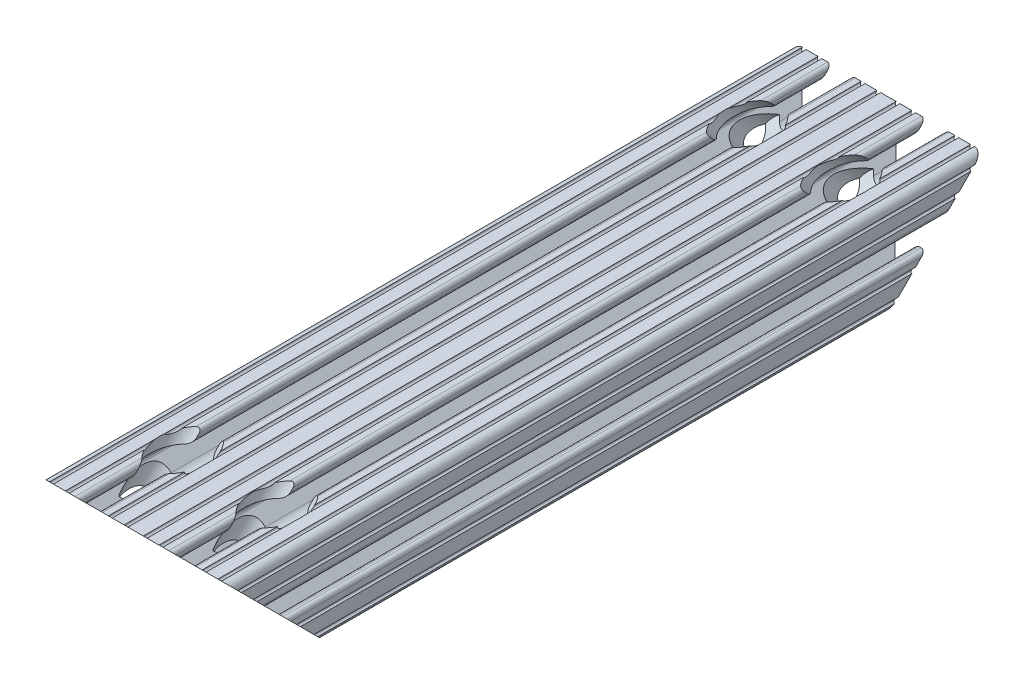
from build123d import *

# Parameters (mm, degrees)
SKETCH1_R               = 3.3274
BOSS_EXTRUDE1_DEPTH     = 152.4
CUT_EXTRUDE1_DEPTH      = 159.253130836
CUT_EXTRUDE1_DEPTH_BACK = 159.253130836


with BuildPart() as part:
    # Sketch1 → Boss-Extrude1 (new, symmetric)
    with BuildSketch(Plane.XY):
        with BuildLine():
            Line((8.915756335, 13.510467785), (8.915756335, 14.073045205))
            ThreePointArc((8.915756335, 14.073045205), (9.176138407, 14.701663134), (9.804756335, 14.962045205))
            Line((9.804756335, 14.962045205), (13.4112, 14.962045205))
            ThreePointArc((13.4112, 14.962045205), (14.524751759, 15.423293446), (14.986, 16.536845205))
            Line((14.986, 16.536845205), (14.986, 17.472817786))
            ThreePointArc((14.986, 17.472817786), (14.531070222, 18.571115427), (13.432772581, 19.026045205))
            Line((13.432772581, 19.026045205), (10.997536067, 19.026045205))
            ThreePointArc((10.997536067, 19.026045205), (10.235536067, 18.264045205), (9.473536067, 19.026045205))
            Line((9.473536067, 19.026045205), (4.645121376, 19.026045205))
            ThreePointArc((4.645121376, 19.026045205), (3.883121376, 18.264045205), (3.121121376, 19.026045205))
            Line((3.121121376, 19.026045205), (-3.121121376, 19.026045205))
            ThreePointArc((-3.121121376, 19.026045205), (-3.883121376, 18.264045205), (-4.645121376, 19.026045205))
            Line((-4.645121376, 19.026045205), (-9.473536067, 19.026045205))
            ThreePointArc((-9.473536067, 19.026045205), (-10.235536067, 18.264045205), (-10.997536067, 19.026045205))
            Line((-10.997536067, 19.026045205), (-13.432772581, 19.026045205))
            ThreePointArc((-13.432772581, 19.026045205), (-14.531070222, 18.571115427), (-14.986, 17.472817786))
            Line((-14.986, 17.472817786), (-14.986, 16.536845205))
            ThreePointArc((-14.986, 16.536845205), (-14.524751759, 15.423293446), (-13.4112, 14.962045205))
            Line((-13.4112, 14.962045205), (-9.804756335, 14.962045205))
            ThreePointArc((-9.804756335, 14.962045205), (-9.176138407, 14.701663134), (-8.915756335, 14.073045205))
            Line((-8.915756335, 14.073045205), (-8.915756335, 13.510467785))
            ThreePointArc((-8.915756335, 13.510467785), (-8.983427007, 13.170263239), (-9.176136839, 12.881851425))
            Line((-9.176136839, 12.881851425), (-13.852498595, 8.205466336))
            ThreePointArc((-13.852498595, 8.205466336), (-15.393447522, 7.17583301), (-17.211122763, 6.814273746))
            Line((-17.211122763, 6.814273746), (-20.888877237, 6.814273746))
            ThreePointArc((-20.888877237, 6.814273746), (-22.706552478, 7.17583301), (-24.247501405, 8.205466336))
            Line((-24.247501405, 8.205466336), (-28.923863161, 12.881851425))
            ThreePointArc((-28.923863161, 12.881851425), (-29.116572993, 13.170263239), (-29.184243665, 13.510467785))
            Line((-29.184243665, 13.510467785), (-29.184243665, 14.073045205))
            ThreePointArc((-29.184243665, 14.073045205), (-28.923861593, 14.701663134), (-28.295243665, 14.962045205))
            Line((-28.295243665, 14.962045205), (-24.6888, 14.962045205))
            ThreePointArc((-24.6888, 14.962045205), (-23.575248241, 15.423293446), (-23.114, 16.536845205))
            Line((-23.114, 16.536845205), (-23.114, 17.456610551))
            ThreePointArc((-23.114, 17.456610551), (-23.53023695, 18.523253274), (-24.558915796, 19.026045205))
            Line((-24.558915796, 19.026045205), (-26.945817468, 19.026045205))
            ThreePointArc((-26.945817468, 19.026045205), (-27.707817468, 18.264045205), (-28.469817468, 19.026045205))
            Line((-28.469817468, 19.026045205), (-33.296256263, 19.026045205))
            ThreePointArc((-33.296256263, 19.026045205), (-34.081312886, 18.287821595), (-34.819536496, 19.072878217))
            ThreePointArc((-34.819536496, 19.072878217), (-37.148019028, 18.168059227), (-38.137614868, 15.874322456))
            ThreePointArc((-38.137614868, 15.874322456), (-37.338232276, 15.132064588), (-38.1, 14.35125142))
            Line((-38.1, 14.35125142), (-38.1, 9.525746878))
            ThreePointArc((-38.1, 9.525746878), (-37.338, 8.763746878), (-38.1, 8.001746878))
            Line((-38.1, 8.001746878), (-38.1, 5.614845205))
            ThreePointArc((-38.1, 5.614845205), (-37.638751759, 4.501293446), (-36.5252, 4.040045205))
            Line((-36.5252, 4.040045205), (-35.6108, 4.040045205))
            ThreePointArc((-35.6108, 4.040045205), (-34.497248241, 4.501293446), (-34.036, 5.614845205))
            Line((-34.036, 5.614845205), (-34.036, 9.374045205))
            ThreePointArc((-34.036, 9.374045205), (-33.775617928, 10.002663134), (-33.147, 10.263045205))
            Line((-33.147, 10.263045205), (-32.420656743, 10.263045205))
            ThreePointArc((-32.420656743, 10.263045205), (-32.080450147, 10.195373685), (-31.792037247, 10.002661566))
            Line((-31.792037247, 10.002661566), (-27.197575832, 5.408177226))
            ThreePointArc((-27.197575832, 5.408177226), (-26.167954729, 3.867234109), (-25.8064, 2.049569816))
            Line((-25.8064, 2.049569816), (-25.8064, -2.097479405))
            ThreePointArc((-25.8064, -2.097479405), (-26.167954729, -3.915143698), (-27.197575832, -5.456086815))
            Line((-27.197575832, -5.456086815), (-31.792037247, -10.050571155))
            ThreePointArc((-31.792037247, -10.050571155), (-32.080450147, -10.243283275), (-32.420656743, -10.310954795))
            Line((-32.420656743, -10.310954795), (-33.147, -10.310954795))
            ThreePointArc((-33.147, -10.310954795), (-33.775617928, -10.050572723), (-34.036, -9.421954795))
            Line((-34.036, -9.421954795), (-34.036, -5.662754795))
            ThreePointArc((-34.036, -5.662754795), (-34.497248241, -4.549203036), (-35.6108, -4.087954795))
            Line((-35.6108, -4.087954795), (-36.5252, -4.087954795))
            ThreePointArc((-36.5252, -4.087954795), (-37.638751759, -4.549203036), (-38.1, -5.662754795))
            Line((-38.1, -5.662754795), (-38.1, -8.049656467))
            ThreePointArc((-38.1, -8.049656467), (-37.338, -8.811656467), (-38.1, -9.573656467))
            Line((-38.1, -9.573656467), (-38.1, -15.059974007))
            ThreePointArc((-38.1, -15.059974007), (-37.338, -15.821974007), (-38.1, -16.583974007))
            ThreePointArc((-38.1, -16.583974007), (-37.20882252, -18.207957251), (-35.571273398, -19.073954795))
            ThreePointArc((-35.571273398, -19.073954795), (-34.809273398, -18.311954795), (-34.047273398, -19.073954795))
            Line((-34.047273398, -19.073954795), (-28.469817469, -19.073954795))
            ThreePointArc((-28.469817469, -19.073954795), (-27.707817469, -18.311954795), (-26.945817469, -19.073954795))
            Line((-26.945817469, -19.073954795), (-24.6888, -19.073954795))
            ThreePointArc((-24.6888, -19.073954795), (-23.575248241, -18.612706554), (-23.114, -17.499154795))
            Line((-23.114, -17.499154795), (-23.114, -16.584754795))
            ThreePointArc((-23.114, -16.584754795), (-23.575248241, -15.471203036), (-24.6888, -15.009954795))
            Line((-24.6888, -15.009954795), (-28.448, -15.009954795))
            ThreePointArc((-28.448, -15.009954795), (-29.076617928, -14.749572723), (-29.337, -14.120954795))
            Line((-29.337, -14.120954795), (-29.337, -13.711134472))
            ThreePointArc((-29.337, -13.711134472), (-29.269329329, -13.370929926), (-29.076619497, -13.082518112))
            Line((-29.076619497, -13.082518112), (-24.247501405, -8.253375925))
            ThreePointArc((-24.247501405, -8.253375925), (-22.706552478, -7.223742599), (-20.888877237, -6.862183335))
            Line((-20.888877237, -6.862183335), (-17.211122763, -6.862183335))
            ThreePointArc((-17.211122763, -6.862183335), (-15.393447522, -7.223742599), (-13.852498595, -8.253375925))
            Line((-13.852498595, -8.253375925), (-9.023380503, -13.082518112))
            ThreePointArc((-9.023380503, -13.082518112), (-8.830670671, -13.370929926), (-8.763, -13.711134472))
            Line((-8.763, -13.711134472), (-8.763, -14.120954795))
            ThreePointArc((-8.763, -14.120954795), (-9.023382072, -14.749572723), (-9.652, -15.009954795))
            Line((-9.652, -15.009954795), (-13.4112, -15.009954795))
            ThreePointArc((-13.4112, -15.009954795), (-14.524751759, -15.471203036), (-14.986, -16.584754795))
            Line((-14.986, -16.584754795), (-14.986, -17.499154795))
            ThreePointArc((-14.986, -17.499154795), (-14.524751759, -18.612706554), (-13.4112, -19.073954795))
            Line((-13.4112, -19.073954795), (-10.997536067, -19.073954795))
            ThreePointArc((-10.997536067, -19.073954795), (-10.235536067, -18.311954795), (-9.473536067, -19.073954795))
            Line((-9.473536067, -19.073954795), (-4.645121376, -19.073954795))
            ThreePointArc((-4.645121376, -19.073954795), (-3.883121376, -18.311954795), (-3.121121376, -19.073954795))
            Line((-3.121121376, -19.073954795), (3.121121376, -19.073954795))
            ThreePointArc((3.121121376, -19.073954795), (3.883121376, -18.311954795), (4.645121376, -19.073954795))
            Line((4.645121376, -19.073954795), (9.473536067, -19.073954795))
            ThreePointArc((9.473536067, -19.073954795), (10.235536067, -18.311954795), (10.997536067, -19.073954795))
            Line((10.997536067, -19.073954795), (13.4112, -19.073954795))
            ThreePointArc((13.4112, -19.073954795), (14.524751759, -18.612706554), (14.986, -17.499154795))
            Line((14.986, -17.499154795), (14.986, -16.584754795))
            ThreePointArc((14.986, -16.584754795), (14.524751759, -15.471203036), (13.4112, -15.009954795))
            Line((13.4112, -15.009954795), (9.652, -15.009954795))
            ThreePointArc((9.652, -15.009954795), (9.023382072, -14.749572723), (8.763, -14.120954795))
            Line((8.763, -14.120954795), (8.763, -13.711134472))
            ThreePointArc((8.763, -13.711134472), (8.830670671, -13.370929926), (9.023380503, -13.082518112))
            Line((9.023380503, -13.082518112), (13.852498595, -8.253375925))
            ThreePointArc((13.852498595, -8.253375925), (15.393447522, -7.223742599), (17.211122763, -6.862183335))
            Line((17.211122763, -6.862183335), (20.888877237, -6.862183335))
            ThreePointArc((20.888877237, -6.862183335), (22.706552478, -7.223742599), (24.247501405, -8.253375925))
            Line((24.247501405, -8.253375925), (29.076619497, -13.082518112))
            ThreePointArc((29.076619497, -13.082518112), (29.269329329, -13.370929926), (29.337, -13.711134472))
            Line((29.337, -13.711134472), (29.337, -14.120954795))
            ThreePointArc((29.337, -14.120954795), (29.076617928, -14.749572723), (28.448, -15.009954795))
            Line((28.448, -15.009954795), (24.6888, -15.009954795))
            ThreePointArc((24.6888, -15.009954795), (23.575248241, -15.471203036), (23.114, -16.584754795))
            Line((23.114, -16.584754795), (23.114, -17.499154795))
            ThreePointArc((23.114, -17.499154795), (23.575248241, -18.612706554), (24.6888, -19.073954795))
            Line((24.6888, -19.073954795), (26.945817469, -19.073954795))
            ThreePointArc((26.945817469, -19.073954795), (27.707817469, -18.311954795), (28.469817469, -19.073954795))
            Line((28.469817469, -19.073954795), (34.047273398, -19.073954795))
            ThreePointArc((34.047273398, -19.073954795), (34.809273398, -18.311954795), (35.571273398, -19.073954795))
            ThreePointArc((35.571273398, -19.073954795), (37.207577603, -18.206692961), (38.1, -16.583974007))
            ThreePointArc((38.1, -16.583974007), (37.338, -15.821974007), (38.1, -15.059974007))
            Line((38.1, -15.059974007), (38.1, -9.573656467))
            ThreePointArc((38.1, -9.573656467), (37.338, -8.811656467), (38.1, -8.049656467))
            Line((38.1, -8.049656467), (38.1, -5.662754795))
            ThreePointArc((38.1, -5.662754795), (37.638751759, -4.549203036), (36.5252, -4.087954795))
            Line((36.5252, -4.087954795), (35.6108, -4.087954795))
            ThreePointArc((35.6108, -4.087954795), (34.497248241, -4.549203036), (34.036, -5.662754795))
            Line((34.036, -5.662754795), (34.036, -9.421954795))
            ThreePointArc((34.036, -9.421954795), (33.775617928, -10.050572723), (33.147, -10.310954795))
            Line((33.147, -10.310954795), (32.420656743, -10.310954795))
            ThreePointArc((32.420656743, -10.310954795), (32.080450147, -10.243283275), (31.792037247, -10.050571155))
            Line((31.792037247, -10.050571155), (27.197575832, -5.456086815))
            ThreePointArc((27.197575832, -5.456086815), (26.167954729, -3.915143698), (25.8064, -2.097479405))
            Line((25.8064, -2.097479405), (25.8064, 2.049569816))
            ThreePointArc((25.8064, 2.049569816), (26.167954729, 3.867234109), (27.197575832, 5.408177226))
            Line((27.197575832, 5.408177226), (31.792037247, 10.002661566))
            ThreePointArc((31.792037247, 10.002661566), (32.080450147, 10.195373685), (32.420656743, 10.263045205))
            Line((32.420656743, 10.263045205), (33.147, 10.263045205))
            ThreePointArc((33.147, 10.263045205), (33.775617928, 10.002663134), (34.036, 9.374045205))
            Line((34.036, 9.374045205), (34.036, 5.614845205))
            ThreePointArc((34.036, 5.614845205), (34.497248241, 4.501293446), (35.6108, 4.040045205))
            Line((35.6108, 4.040045205), (36.5252, 4.040045205))
            ThreePointArc((36.5252, 4.040045205), (37.638751759, 4.501293446), (38.1, 5.614845205))
            Line((38.1, 5.614845205), (38.1, 8.001746878))
            ThreePointArc((38.1, 8.001746878), (37.338, 8.763746878), (38.1, 9.525746878))
            Line((38.1, 9.525746878), (38.1, 14.35125142))
            ThreePointArc((38.1, 14.35125142), (37.338232276, 15.132064588), (38.137614868, 15.874322456))
            ThreePointArc((38.137614868, 15.874322456), (37.148019028, 18.168059227), (34.819536496, 19.072878217))
            ThreePointArc((34.819536496, 19.072878217), (34.081312886, 18.287821595), (33.296256263, 19.026045205))
            Line((33.296256263, 19.026045205), (28.469817468, 19.026045205))
            ThreePointArc((28.469817468, 19.026045205), (27.707817468, 18.264045205), (26.945817468, 19.026045205))
            Line((26.945817468, 19.026045205), (24.558915796, 19.026045205))
            ThreePointArc((24.558915796, 19.026045205), (23.53023695, 18.523253274), (23.114, 17.456610551))
            Line((23.114, 17.456610551), (23.114, 16.536845205))
            ThreePointArc((23.114, 16.536845205), (23.575248241, 15.423293446), (24.6888, 14.962045205))
            Line((24.6888, 14.962045205), (28.295243665, 14.962045205))
            ThreePointArc((28.295243665, 14.962045205), (28.923861593, 14.701663134), (29.184243665, 14.073045205))
            Line((29.184243665, 14.073045205), (29.184243665, 13.510467785))
            ThreePointArc((29.184243665, 13.510467785), (29.116572993, 13.170263239), (28.923863161, 12.881851425))
            Line((28.923863161, 12.881851425), (24.247501405, 8.205466336))
            ThreePointArc((24.247501405, 8.205466336), (22.706552478, 7.17583301), (20.888877237, 6.814273746))
            Line((20.888877237, 6.814273746), (17.211122763, 6.814273746))
            ThreePointArc((17.211122763, 6.814273746), (15.393447522, 7.17583301), (13.852498595, 8.205466336))
            Line((13.852498595, 8.205466336), (9.176136839, 12.881851425))
            ThreePointArc((9.176136839, 12.881851425), (8.983427007, 13.170263239), (8.915756335, 13.510467785))
        make_face()
        with Locations((19.05, -0.023954795)):
            Circle(SKETCH1_R, mode=Mode.SUBTRACT)
        with Locations((-19.05, -0.023954795)):
            Circle(SKETCH1_R, mode=Mode.SUBTRACT)
        with BuildLine():
            Line((-10.902424168, -5.456086815), (-2.077035361, -14.281519658))
            ThreePointArc((-2.077035361, -14.281519658), (-1.124045601, -14.916927806), (0, -15.137051601))
            ThreePointArc((0, -15.137051601), (1.124045601, -14.916927806), (2.077035361, -14.281519658))
            Line((2.077035361, -14.281519658), (10.902424168, -5.456086815))
            ThreePointArc((10.902424168, -5.456086815), (11.932045271, -3.915143698), (12.2936, -2.097479405))
            Line((12.2936, -2.097479405), (12.2936, 2.049569816))
            ThreePointArc((12.2936, 2.049569816), (11.932045271, 3.867234109), (10.902424168, 5.408177226))
            Line((10.902424168, 5.408177226), (2.077035361, 14.233610068))
            ThreePointArc((2.077035361, 14.233610068), (1.124045601, 14.869018217), (0, 15.089142012))
            ThreePointArc((0, 15.089142012), (-1.124045601, 14.869018217), (-2.077035361, 14.233610068))
            Line((-2.077035361, 14.233610068), (-10.902424168, 5.408177226))
            ThreePointArc((-10.902424168, 5.408177226), (-11.932045271, 3.867234109), (-12.2936, 2.049569816))
            Line((-12.2936, 2.049569816), (-12.2936, -2.097479405))
            ThreePointArc((-12.2936, -2.097479405), (-11.932045271, -3.915143698), (-10.902424168, -5.456086815))
        make_face(mode=Mode.SUBTRACT)
    extrude(amount=BOSS_EXTRUDE1_DEPTH, both=True)

    # Sketch2 → Cut-Extrude1 (cut, two sides: drawn at the far end of the back side and taken through both)
    with BuildSketch(Plane(origin=(0, 0, 0), x_dir=(0, 0, -1), z_dir=(1, 0, 0)).offset(-CUT_EXTRUDE1_DEPTH_BACK)):
        Polygon((-152.4, 19.026045205), (-152.4, -19.073954795), (-114.3, -19.073954795), align=None)
        Polygon((114.3, -19.073954795), (152.4, 19.026045205), (152.4, -19.073954795), align=None)
    extrude(amount=CUT_EXTRUDE1_DEPTH + CUT_EXTRUDE1_DEPTH_BACK, mode=Mode.SUBTRACT)

    # Sketch3 → Cut-Revolve1 (revolve, cut)
    with BuildSketch(Plane(origin=(-19.05, 0, 0), x_dir=(0, 0, -1), z_dir=(1, 0, 0))):
        Polygon((-107.564807909, 25.761237296), (-133.35, -0.023954795), (-136.295524008, 2.921569213), (-131.805395947, 7.411697274), (-135.59506403, 11.201365357), (-114.3, 32.496429387), align=None)
    cut_revolve1 = revolve(axis=Axis((-19.05, -0.023954795, 133.35), (0, -0.7071067811865464, 0.7071067811865487)), mode=Mode.SUBTRACT)

    # Mirror1: Cut-Revolve1 across plane
    add(cut_revolve1.mirror(Plane.XY), mode=Mode.SUBTRACT)

    # Mirror2: Cut-Revolve1 across plane
    add(cut_revolve1.mirror(Plane(origin=(0, 0, 0), x_dir=(0, 0, 1), z_dir=(1, 0, 0))), mode=Mode.SUBTRACT)

    # Mirror2 copy 1 sketch → Mirror2 copy 1 (revolve, cut)
    with BuildSketch(Plane.ZY.offset(-19.05)):
        Polygon((-107.564807909, 25.761237296), (-133.35, -0.023954795), (-136.295524008, 2.921569213), (-131.805395947, 7.411697274), (-135.59506403, 11.201365357), (-114.3, 32.496429387), align=None)
    revolve(axis=Axis((19.05, -0.023954795, -133.35), (0, -0.7071067811865464, -0.7071067811865487)), mode=Mode.SUBTRACT)


solid = part.part
